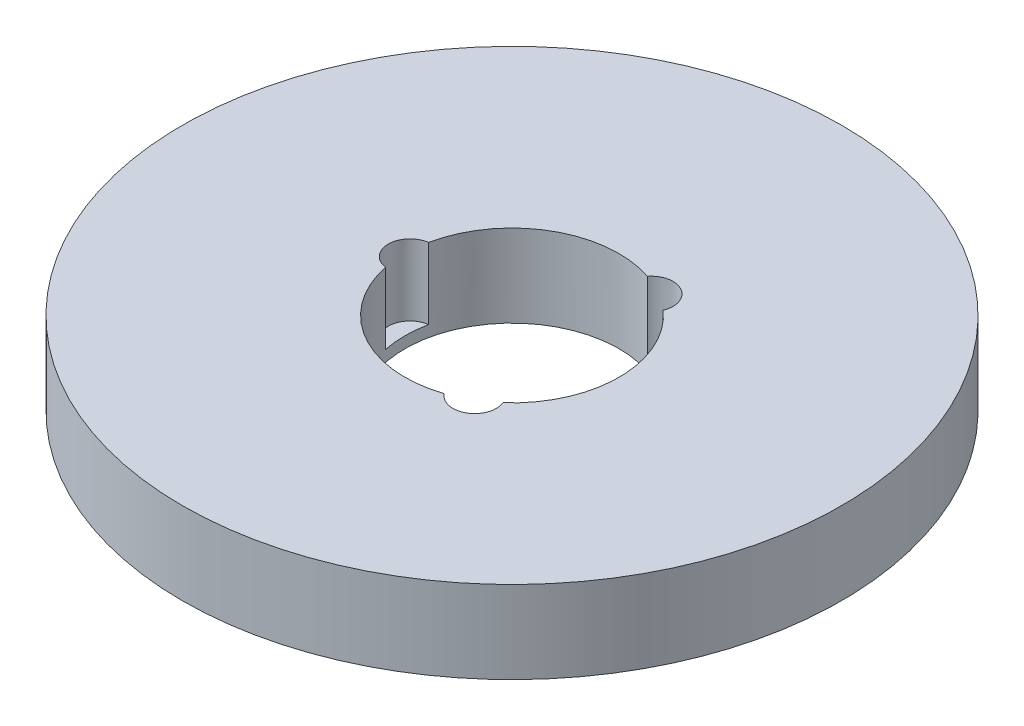
from build123d import *

# Parameters (mm, degrees)
SKETCH1_R           = 100
BOSS_EXTRUDE1_DEPTH = 25
SKETCH2_R           = 32.5
CUT_EXTRUDE1_DEPTH  = 144.614066163
SKETCH3_R           = 6.585572089
CUT_EXTRUDE2_DEPTH  = 21.587251006
CIRPATTERN1_COUNT   = 3


with BuildPart() as part:
    # Sketch1 → Boss-Extrude1 (new body)
    with BuildSketch(Plane(origin=(0, 0, 0), x_dir=(1, 0, 0), z_dir=(0, 1, 0))):
        Circle(SKETCH1_R)
    extrude(amount=BOSS_EXTRUDE1_DEPTH)

    # Sketch2 → Cut-Extrude1 (cut, through all)
    with BuildSketch(Plane(origin=(0, 0, 0), x_dir=(1, 0, 0), z_dir=(0, 1, 0))):
        Circle(SKETCH2_R)
    extrude(amount=CUT_EXTRUDE1_DEPTH, mode=Mode.SUBTRACT)

    # Sketch3 → Cut-Extrude2 (cut)
    with BuildSketch(Plane(origin=(0, 25, 0), x_dir=(1, 0, 0), z_dir=(0, 1, 0))):
        with Locations((-30.951891748, 0)):
            Circle(SKETCH3_R)
    cut_extrude2 = extrude(amount=-CUT_EXTRUDE2_DEPTH, mode=Mode.SUBTRACT)

    # CirPattern1: Cut-Extrude2 ×3 about axis
    cirpattern1_axis = Axis((0, 0, 0), (0, 1, 0))
    for i in range(1, CIRPATTERN1_COUNT):
        add(cut_extrude2.rotate(cirpattern1_axis, i * 360 / CIRPATTERN1_COUNT), mode=Mode.SUBTRACT)


solid = part.part
